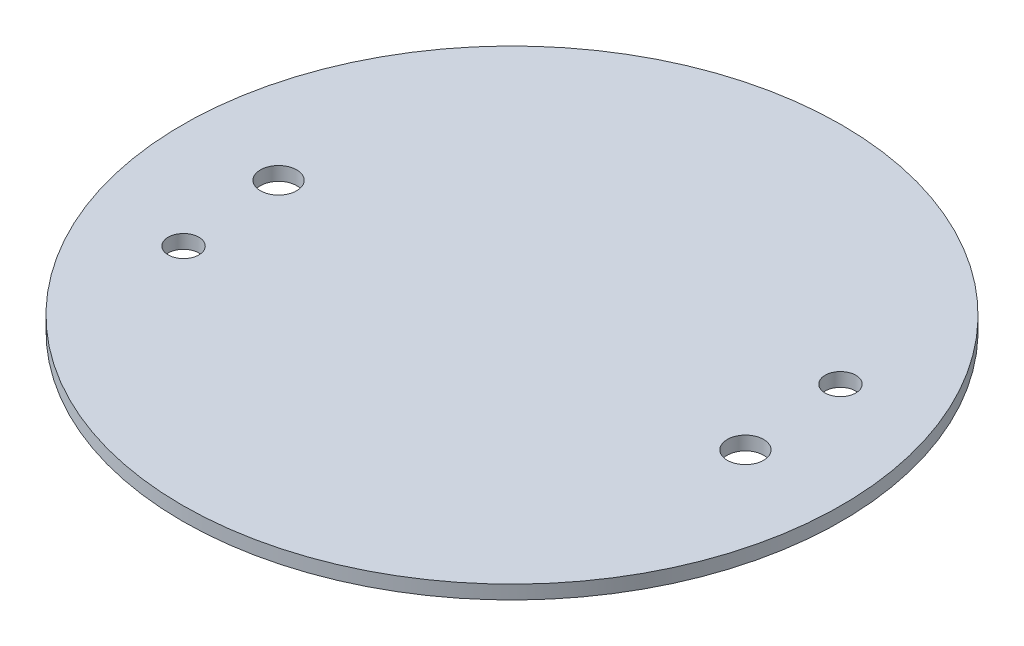
from build123d import *

# Parameters (mm, degrees)
SKETCH1_R           = 76.2
BOSS_EXTRUDE1_DEPTH = 3.175
SKETCH2_R           = 3.556
SKETCH2_R_2         = 4.191
CUT_EXTRUDE1_DEPTH  = 3.175


with BuildPart() as part:
    # Sketch1 → Boss-Extrude1 (new body)
    with BuildSketch(Plane(origin=(0, 0, 0), x_dir=(1, 0, 0), z_dir=(0, 1, 0))):
        Circle(SKETCH1_R)
    extrude(amount=BOSS_EXTRUDE1_DEPTH)

    # Sketch2 → Cut-Extrude1 (cut)
    with BuildSketch(Plane(origin=(0, 3.175, 0), x_dir=(1, 0, 0), z_dir=(0, 1, 0))):
        with Locations((-51.795490029, -24.152633658)):
            Circle(SKETCH2_R)
        with Locations((51.795490029, 24.152633658)):
            Circle(SKETCH2_R)
        with Locations((-53.975, 0)):
            Circle(SKETCH2_R_2)
        with Locations((53.975, 0)):
            Circle(SKETCH2_R_2)
    extrude(amount=-CUT_EXTRUDE1_DEPTH, mode=Mode.SUBTRACT)


solid = part.part
